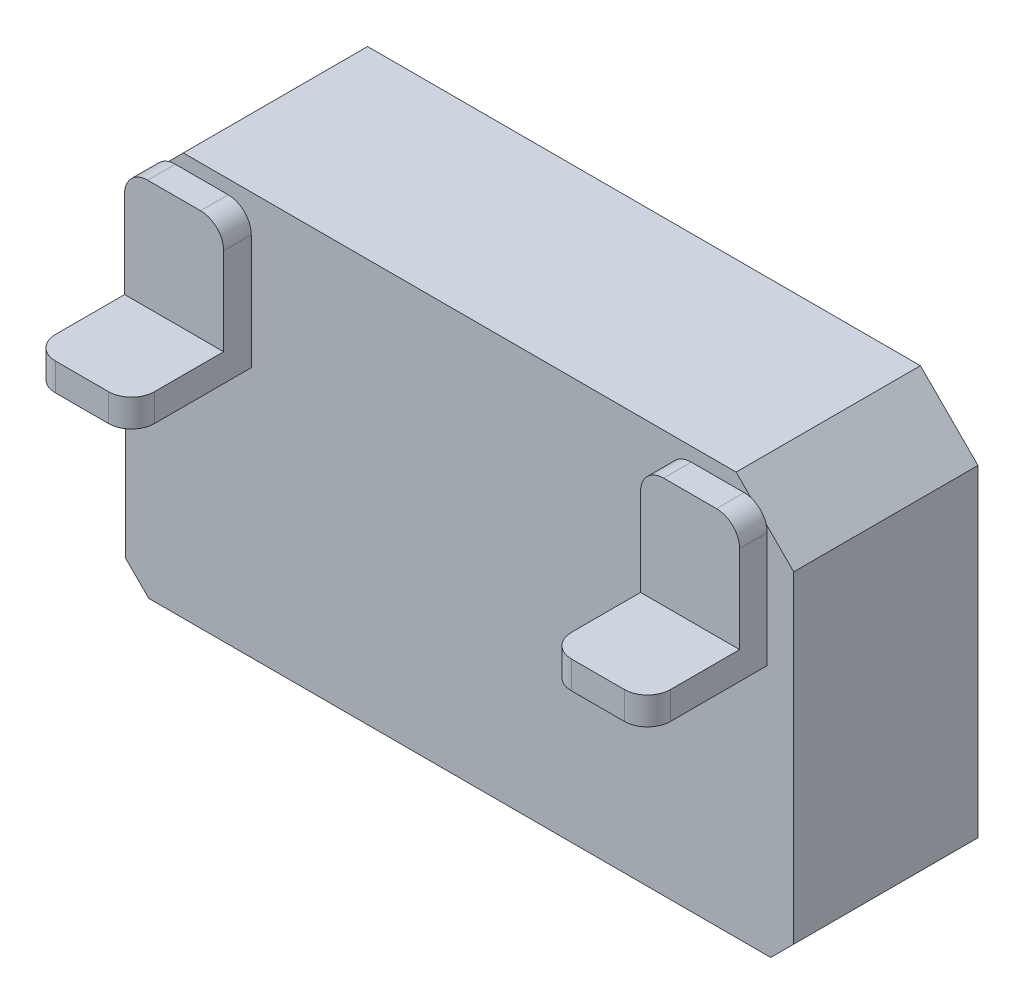
from build123d import *

# Parameters (mm, degrees)
EXTRUDE_1_DEPTH = 80
SKETCH_2_W      = 43
SKETCH_2_H      = 60
EXTRUDE_2_DEPTH = 12
SKETCH_3_W      = 43
SKETCH_3_H      = 12
EXTRUDE_3_DEPTH = 40
FILLET_1_R      = 10


with BuildPart() as part:
    # 草图1 → 凸台-拉伸1 (new body)
    with BuildSketch(Plane.XY):
        Polygon((-145, -77.5), (-135, -87.5), (135, -87.5), (145, -77.5), (145, 62.5), (120, 87.5), (-120, 87.5), (-145, 62.5), align=None)
    extrude(amount=EXTRUDE_1_DEPTH)

    # 草图2 → 凸台-拉伸2 (add)
    with BuildSketch(Plane.XY.offset(80)):
        with Locations((-112, 51.5)):
            Rectangle(SKETCH_2_W, SKETCH_2_H)
        with Locations((112, 51.5)):
            Rectangle(SKETCH_2_W, SKETCH_2_H)
    extrude(amount=EXTRUDE_2_DEPTH)

    # 草图3 → 凸台-拉伸3 (add)
    with BuildSketch(Plane.XY.offset(92)):
        with Locations((-112, 27.5)):
            Rectangle(SKETCH_3_W, SKETCH_3_H)
        with Locations((112, 27.5)):
            Rectangle(SKETCH_3_W, SKETCH_3_H)
    extrude(amount=EXTRUDE_3_DEPTH)

    # 圆角1
    # the kernel refuses this fillet: 10 mm, written as the material it takes off along each edge
    with BuildSketch(Plane(origin=(-90.5, 81.5, 80), x_dir=(-1, 0, 0), z_dir=(0, 0, 1)), Plane(origin=(90.5, 81.5, 80), x_dir=(0, -1, 0), z_dir=(0, 0, 1))) as fillet_1_piece_1:
        with BuildLine():
            CenterArc((FILLET_1_R, FILLET_1_R), FILLET_1_R, 180, 90)
            Line((0, FILLET_1_R), (0, 0))
            Line((0, 0), (FILLET_1_R, 0))
        make_face()
    extrude(amount=37, mode=Mode.SUBTRACT)
    with BuildSketch(Plane(origin=(-133.5, 81.5, 80), x_dir=(1, 0, 0), z_dir=(0, 0, 1)), Plane(origin=(133.5, 81.5, 80), x_dir=(0, -1, 0), z_dir=(0, 0, 1))) as fillet_1_piece_2:
        with BuildLine():
            CenterArc((FILLET_1_R, -FILLET_1_R), FILLET_1_R, 90, 90)
            Line((0, -FILLET_1_R), (0, 0))
            Line((0, 0), (FILLET_1_R, 0))
        make_face()
    extrude(amount=37, mode=Mode.SUBTRACT)
    with BuildSketch(Plane(origin=(-133.5, 58.5, 132), x_dir=(1, 0, 0), z_dir=(0, -1, 0)), Plane(origin=(-90.5, -3.5, 132), x_dir=(-1, 0, 0), z_dir=(0, 1, 0)), Plane(origin=(90.5, 58.5, 132), x_dir=(1, 0, 0), z_dir=(0, -1, 0))) as fillet_1_piece_3:
        with BuildLine():
            CenterArc((FILLET_1_R, -FILLET_1_R), FILLET_1_R, 90, 90)
            Line((0, -FILLET_1_R), (0, 0))
            Line((0, 0), (FILLET_1_R, 0))
        make_face()
    extrude(amount=62, mode=Mode.SUBTRACT)
    with BuildSketch(Plane(origin=(133.5, -3.5, 132), x_dir=(0, 0, -1), z_dir=(0, 1, 0))) as fillet_1_piece_4:
        with BuildLine():
            CenterArc((FILLET_1_R, FILLET_1_R), FILLET_1_R, 180, 90)
            Line((0, FILLET_1_R), (0, 0))
            Line((0, 0), (FILLET_1_R, 0))
        make_face()
    extrude(amount=62, mode=Mode.SUBTRACT)


solid = part.part
